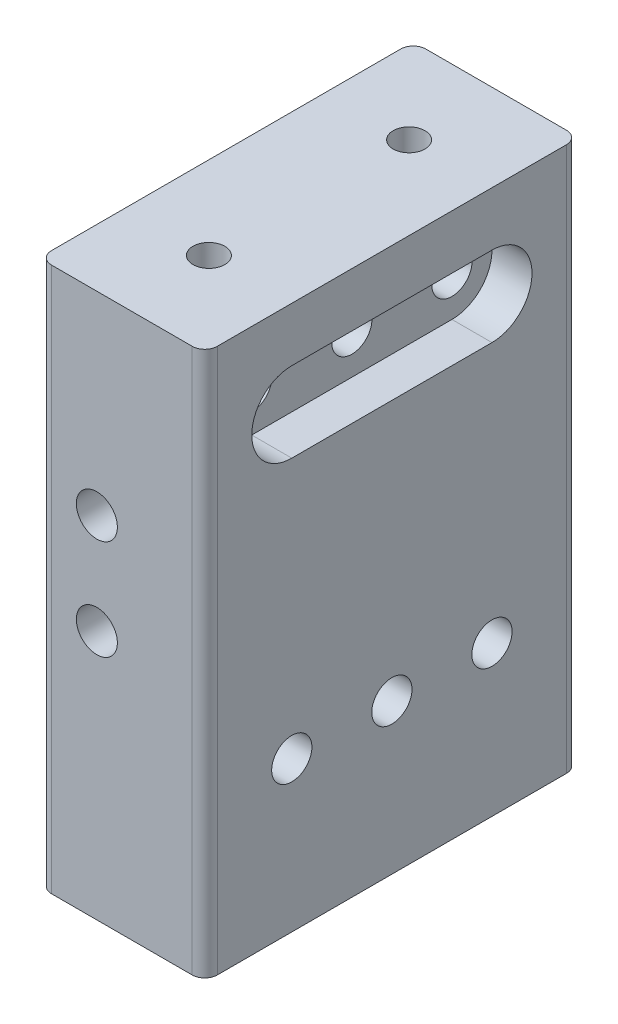
from build123d import *

# Parameters (mm, degrees)
SKETCH1_W           = 21.0312
SKETCH1_H           = 47.4853
BOSS_EXTRUDE1_DEPTH = 31.75
SKETCH2_R           = 2.6035
CUT_EXTRUDE1_DEPTH  = 59.081787674
SKETCH4_R           = 2.5527
CUT_EXTRUDE3_DEPTH  = 45.878584007
FILLET1_R           = 1.5875
CUT_EXTRUDE5_DEPTH  = 5.08
BOSS_EXTRUDE2_DEPTH = 5.588
SKETCH9_R           = 2.0193
CUT_EXTRUDE6_DEPTH  = 5.08
SKETCH10_R          = 2.5527
CUT_EXTRUDE7_DEPTH  = 49.991336443


with BuildPart() as part:
    # Sketch1 → Boss-Extrude1 (new, symmetric)
    with BuildSketch(Plane(origin=(0, 0, 0), x_dir=(1, 0, 0), z_dir=(0, 1, 0))):
        Rectangle(SKETCH1_W, SKETCH1_H)
    extrude(amount=BOSS_EXTRUDE1_DEPTH, both=True)

    # Sketch2 → Cut-Extrude1 (cut, through all)
    with BuildSketch(Plane.XY.offset(23.74265)):
        with Locations((-3.175, 0)):
            Circle(SKETCH2_R)
        with Locations((-3.175, 12.7)):
            Circle(SKETCH2_R)
    extrude(amount=-CUT_EXTRUDE1_DEPTH, mode=Mode.SUBTRACT)

    # Sketch4 → Cut-Extrude3 (cut, through all)
    with BuildSketch(Plane(origin=(10.5156, 0, 0), x_dir=(0, 0, -1), z_dir=(1, 0, 0))):
        with Locations((-12.7, 25.4)):
            Circle(SKETCH4_R)
        with Locations((12.7, 25.4)):
            Circle(SKETCH4_R)
        with Locations((0, 25.4)):
            Circle(SKETCH4_R)
    extrude(amount=-CUT_EXTRUDE3_DEPTH, mode=Mode.SUBTRACT)

    # Fillet1
    fillet1_edges = [part.edges().sort_by_distance(p)[0] for p in [
        (10.5156, 0, 23.74265),
        (-10.5156, 0, 23.74265),
        (-10.5156, 0, -23.74265),
        (10.5156, 0, -23.74265),
    ]]
    fillet(fillet1_edges, radius=FILLET1_R)

    # Sketch7 → Cut-Extrude5 (cut)
    with BuildSketch(Plane(origin=(10.5156, 0, 0), x_dir=(0, 0, -1), z_dir=(1, 0, 0))):
        with BuildLine():
            Line((-12.7, 30.48), (12.7, 30.48))
            ThreePointArc((12.7, 30.48), (17.78, 25.4), (12.7, 20.32))
            Line((12.7, 20.32), (-12.7, 20.32))
            ThreePointArc((-12.7, 20.32), (-17.78, 25.4), (-12.7, 30.48))
        make_face()
    extrude(amount=-CUT_EXTRUDE5_DEPTH, mode=Mode.SUBTRACT)

    # Sketch8 → Boss-Extrude2 (add)
    with BuildSketch(Plane(origin=(0, 31.75, 0), x_dir=(1, 0, 0), z_dir=(0, 1, 0))):
        with BuildLine():
            Line((-8.9281, -23.74265), (8.9281, -23.74265))
            ThreePointArc((8.9281, -23.74265), (10.050632015, -23.277682015), (10.5156, -22.15515))
            Line((10.5156, -22.15515), (10.5156, 22.15515))
            ThreePointArc((10.5156, 22.15515), (10.050632015, 23.277682015), (8.9281, 23.74265))
            Line((8.9281, 23.74265), (-8.9281, 23.74265))
            ThreePointArc((-8.9281, 23.74265), (-10.050632015, 23.277682015), (-10.5156, 22.15515))
            Line((-10.5156, 22.15515), (-10.5156, -22.15515))
            ThreePointArc((-10.5156, -22.15515), (-10.050632015, -23.277682015), (-8.9281, -23.74265))
        make_face()
    extrude(amount=BOSS_EXTRUDE2_DEPTH)

    # Sketch9 → Cut-Extrude6 (cut)
    with BuildSketch(Plane(origin=(0, 37.338, 0), x_dir=(1, 0, 0), z_dir=(0, 1, 0))):
        with Locations((0, 12.7)):
            Circle(SKETCH9_R)
        with Locations((0, -12.7)):
            Circle(SKETCH9_R)
    extrude(amount=-CUT_EXTRUDE6_DEPTH, mode=Mode.SUBTRACT)

    # Sketch10 → Cut-Extrude7 (cut, through all)
    with BuildSketch(Plane(origin=(10.5156, 0, 0), x_dir=(0, 0, -1), z_dir=(1, 0, 0))):
        with Locations((0, -12.7)):
            Circle(SKETCH10_R)
        with Locations((12.7, -12.7)):
            Circle(SKETCH10_R)
        with Locations((-12.7, -12.7)):
            Circle(SKETCH10_R)
    extrude(amount=-CUT_EXTRUDE7_DEPTH, mode=Mode.SUBTRACT)


solid = part.part
